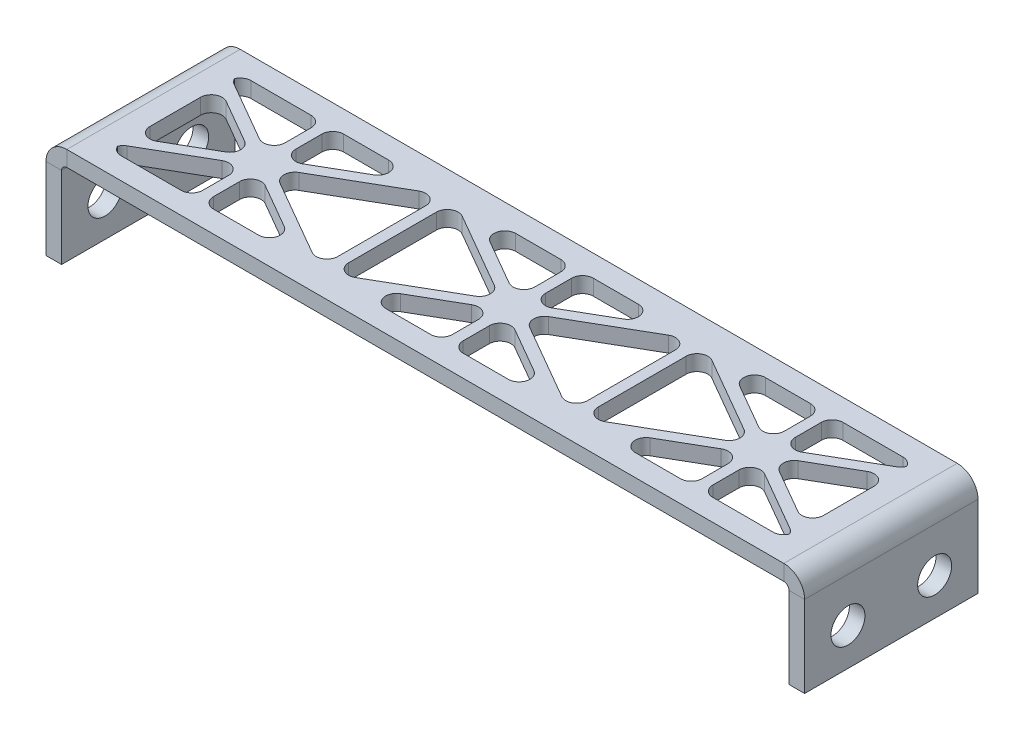
from build123d import *

# Parameters (mm, degrees)
BASE_FLANGE1_DEPTH      = 25.4
CUT_EXTRUDE1_DEPTH      = 62.700339563
CUT_EXTRUDE1_DEPTH_BACK = 62.700339563
SKETCH6_R               = 2.4892
CUT_EXTRUDE4_DEPTH      = 63.904146145
FILLET1_R               = 1.5875


# Sheet-metal steps are written as plain solids
with BuildPart() as part:
    # Sketch1 → Base-Flange1 (new body)
    with BuildSketch(Plane.XY):
        with BuildLine():
            Line((-53.2765, -6.35), (-53.2765, 5.588))
            ThreePointArc((-53.2765, 5.588), (-53.053315367, 6.126815367), (-52.5145, 6.35))
            Line((-52.5145, 6.35), (52.5145, 6.35))
            ThreePointArc((52.5145, 6.35), (53.053315367, 6.126815367), (53.2765, 5.588))
            Line((53.2765, 5.588), (53.2765, -6.35))
            Line((53.2765, -6.35), (55.5625, -6.35))
            Line((55.5625, -6.35), (55.5625, 5.588))
            ThreePointArc((55.5625, 5.588), (54.669761469, 7.743261469), (52.5145, 8.636))
            Line((52.5145, 8.636), (-52.5145, 8.636))
            ThreePointArc((-52.5145, 8.636), (-54.669761469, 7.743261469), (-55.5625, 5.588))
            Line((-55.5625, 5.588), (-55.5625, -6.35))
            Line((-55.5625, -6.35), (-53.2765, -6.35))
        make_face()
    extrude(amount=BASE_FLANGE1_DEPTH)

    # Sketch6 → Cut-Extrude1 (cut, two sides: drawn at the far end of the back side and taken through both)
    with BuildSketch(Plane(origin=(0, 0, 0), x_dir=(0, 0, -1), z_dir=(1, 0, 0)).offset(-CUT_EXTRUDE1_DEPTH_BACK)):
        with Locations((19.05, -0.888959106)):
            Circle(SKETCH6_R)
        with Locations((6.35, -0.888959106)):
            Circle(SKETCH6_R)
        with Locations((-6.35, -0.888959106)):
            Circle(SKETCH6_R)
        with Locations((-19.05, -0.888959106)):
            Circle(SKETCH6_R)
    extrude(amount=CUT_EXTRUDE1_DEPTH + CUT_EXTRUDE1_DEPTH_BACK, mode=Mode.SUBTRACT)

    # Sketch8 → Cut-Extrude4 (cut, through all)
    with BuildSketch(Plane(origin=(0, 8.636, 0), x_dir=(1, 0, 0), z_dir=(0, 1, 0))):
        Polygon((49.3395, -19.152466608), (49.3395, -6.247533392), (38.1635, -12.7), align=None)
        Polygon((49.3395, -22.225), (49.3395, -20.985553713), (37.36975, -14.074815329), (37.36975, -22.225), align=None)
        Polygon((35.78225, -22.225), (35.78225, -14.074815329), (21.665716058, -22.225), align=None)
        Polygon((19.08175, -21.883766394), (34.9885, -12.7), (19.08175, -3.516233606), align=None)
        Polygon((35.78225, -11.325184671), (35.78225, -3.175), (21.665716058, -3.175), align=None)
        Polygon((37.36975, -11.325184671), (49.3395, -4.414446287), (49.3395, -3.175), (37.36975, -3.175), align=None)
        Polygon((17.49425, -21.883766394), (17.49425, -3.516233606), (1.5875, -12.7), align=None)
        Polygon((0.79375, -22.225), (14.910283942, -22.225), (0.79375, -14.074815329), align=None)
        Polygon((0.79375, -11.325184671), (14.910283942, -3.175), (0.79375, -3.175), align=None)
        Polygon((-0.79375, -11.325184671), (-0.79375, -3.175), (-14.910283942, -3.175), align=None)
        Polygon((-17.49425, -21.883766394), (-1.5875, -12.7), (-17.49425, -3.516233606), align=None)
        Polygon((-14.910283942, -22.225), (-0.79375, -22.225), (-0.79375, -14.074815329), align=None)
        Polygon((-19.08175, -21.883766394), (-19.08175, -3.516233606), (-34.9885, -12.7), align=None)
        Polygon((-35.78225, -22.225), (-21.665716058, -22.225), (-35.78225, -14.074815329), align=None)
        Polygon((-35.78225, -11.325184671), (-21.665716058, -3.175), (-35.78225, -3.175), align=None)
        Polygon((-37.36975, -11.325184671), (-37.36975, -3.175), (-49.3395, -3.175), (-49.3395, -4.414446287), align=None)
        Polygon((-49.3395, -19.152466608), (-38.1635, -12.7), (-49.3395, -6.247533392), align=None)
        Polygon((-49.3395, -22.225), (-37.36975, -22.225), (-37.36975, -14.074815329), (-49.3395, -20.985553713), align=None)
    extrude(amount=-CUT_EXTRUDE4_DEPTH, mode=Mode.SUBTRACT)

    # Fillet1
    # the kernel refuses this fillet: 1.5875 mm, written as the material it adds along each edge
    with BuildSketch(Plane(origin=(37.36975, 8.636, 3.175), x_dir=(0, 0, 1), z_dir=(0, -1, 0)), Plane(origin=(49.3395, 8.636, 3.175), x_dir=(-1, 0, 0), z_dir=(0, -1, 0)), Plane(origin=(49.3395, 8.636, 22.225), x_dir=(0, 0, -1), z_dir=(0, -1, 0)), Plane(origin=(35.78225, 8.636, 22.225), x_dir=(0, 0, -1), z_dir=(0, -1, 0)), Plane(origin=(35.78225, 8.636, 3.175), x_dir=(-1, 0, 0), z_dir=(0, -1, 0)), Plane(origin=(-49.3395, 8.636, 3.175), x_dir=(0, 0, 1), z_dir=(0, -1, 0)), Plane(origin=(-37.36975, 8.636, 3.175), x_dir=(-1, 0, 0), z_dir=(0, -1, 0)), Plane(origin=(-0.79375, 8.636, 3.175), x_dir=(-1, 0, 0), z_dir=(0, -1, 0)), Plane(origin=(-0.79375, 8.636, 22.225), x_dir=(0, 0, -1), z_dir=(0, -1, 0)), Plane(origin=(-37.36975, 8.636, 22.225), x_dir=(0, 0, -1), z_dir=(0, -1, 0)), Plane(origin=(-49.3395, 8.636, 22.225), x_dir=(1, 0, 0), z_dir=(0, -1, 0))) as fillet1_piece_1:
        with BuildLine():
            CenterArc((FILLET1_R, -FILLET1_R), FILLET1_R, 90, 90)
            Line((0, -FILLET1_R), (0, 0))
            Line((0, 0), (FILLET1_R, 0))
        make_face()
    extrude(amount=2.286)
    with BuildSketch(Plane(origin=(49.3395, 8.636, 4.414446287), x_dir=(0, 0, -1), z_dir=(0, -1, 0)), Plane(origin=(49.3395, 8.636, 20.985553713), x_dir=(-0.8660254037844429, 0, -0.4999999999999925), z_dir=(0, -1, 0)), Plane(origin=(-49.3395, 8.636, 4.414446287), x_dir=(0.8660254037844405, 0, 0.4999999999999969), z_dir=(0, -1, 0)), Plane(origin=(-49.3395, 8.636, 20.985553713), x_dir=(0, 0, 1), z_dir=(0, -1, 0))) as fillet1_piece_2:
        with BuildLine():
            CenterArc((FILLET1_R * 0.57735026919, -FILLET1_R), FILLET1_R, 90, 60)
            Line((-FILLET1_R * 0.288675134595, -FILLET1_R * 0.5), (0, 0))
            Line((0, 0), (FILLET1_R * 0.57735026919, 0))
        make_face()
    extrude(amount=2.286)
    with BuildSketch(Plane(origin=(37.36975, 8.636, 11.325184671), x_dir=(0, 0, -1), z_dir=(0, -1, 0)), Plane(origin=(1.5875, 8.636, 12.7), x_dir=(0.8660254037844406, 0, -0.4999999999999966), z_dir=(0, -1, 0)), Plane(origin=(35.78225, 8.636, 11.325184671), x_dir=(-0.8660254037844403, 0, -0.49999999999999717), z_dir=(0, -1, 0)), Plane(origin=(19.08175, 8.636, 21.883766394), x_dir=(0, 0, -1), z_dir=(0, -1, 0)), Plane(origin=(-37.36975, 8.636, 11.325184671), x_dir=(-0.8660254037844397, 0, -0.49999999999999817), z_dir=(0, -1, 0)), Plane(origin=(-49.3395, 8.636, 19.152466608), x_dir=(0, 0, -1), z_dir=(0, -1, 0)), Plane(origin=(-17.49425, 8.636, 21.883766394), x_dir=(0, 0, -1), z_dir=(0, -1, 0)), Plane(origin=(-0.79375, 8.636, 11.325184671), x_dir=(-0.8660254037844397, 0, -0.4999999999999983), z_dir=(0, -1, 0)), Plane(origin=(-0.79375, 8.636, 14.074815329), x_dir=(0, 0, 1), z_dir=(0, -1, 0)), Plane(origin=(-34.9885, 8.636, 12.7), x_dir=(0.8660254037844405, 0, -0.49999999999999667), z_dir=(0, -1, 0)), Plane(origin=(-37.36975, 8.636, 14.074815329), x_dir=(0, 0, 1), z_dir=(0, -1, 0)), Plane(origin=(49.3395, 8.636, 19.152466608), x_dir=(-0.8660254037844397, 0, -0.49999999999999817), z_dir=(0, -1, 0))) as fillet1_piece_3:
        with BuildLine():
            CenterArc((FILLET1_R * 1.73205080757, FILLET1_R), FILLET1_R, 150, 120)
            Line((FILLET1_R * 0.866025403784, FILLET1_R * 1.5), (0, 0))
            Line((0, 0), (FILLET1_R * 1.73205080757, 0))
        make_face()
    extrude(amount=2.286)
    with BuildSketch(Plane(origin=(17.49425, 8.636, 3.516233606), x_dir=(-0.8660254037844396, 0, 0.49999999999999817), z_dir=(0, -1, 0)), Plane(origin=(17.49425, 8.636, 21.883766394), x_dir=(0, 0, -1), z_dir=(0, -1, 0)), Plane(origin=(0.79375, 8.636, 14.074815329), x_dir=(0, 0, 1), z_dir=(0, -1, 0)), Plane(origin=(0.79375, 8.636, 11.325184671), x_dir=(0.8660254037844398, 0, -0.4999999999999979), z_dir=(0, -1, 0)), Plane(origin=(37.36975, 8.636, 14.074815329), x_dir=(0, 0, 1), z_dir=(0, -1, 0)), Plane(origin=(35.78225, 8.636, 14.074815329), x_dir=(-0.8660254037844395, 0, 0.4999999999999986), z_dir=(0, -1, 0)), Plane(origin=(19.08175, 8.636, 3.516233606), x_dir=(0, 0, 1), z_dir=(0, -1, 0)), Plane(origin=(34.9885, 8.636, 12.7), x_dir=(-0.866025403784439, 0, -0.4999999999999993), z_dir=(0, -1, 0)), Plane(origin=(-38.1635, 8.636, 12.7), x_dir=(-0.8660254037844394, 0, -0.4999999999999986), z_dir=(0, -1, 0)), Plane(origin=(-49.3395, 8.636, 6.247533392), x_dir=(0, 0, 1), z_dir=(0, -1, 0)), Plane(origin=(-35.78225, 8.636, 11.325184671), x_dir=(0.86602540378444, 0, -0.49999999999999767), z_dir=(0, -1, 0)), Plane(origin=(-35.78225, 8.636, 14.074815329), x_dir=(0, 0, 1), z_dir=(0, -1, 0)), Plane(origin=(-17.49425, 8.636, 3.516233606), x_dir=(0, 0, 1), z_dir=(0, -1, 0)), Plane(origin=(-1.5875, 8.636, 12.7), x_dir=(-0.8660254037844406, 0, -0.4999999999999966), z_dir=(0, -1, 0)), Plane(origin=(-19.08175, 8.636, 3.516233606), x_dir=(-0.8660254037844397, 0, 0.499999999999998), z_dir=(0, -1, 0)), Plane(origin=(-19.08175, 8.636, 21.883766394), x_dir=(0, 0, -1), z_dir=(0, -1, 0)), Plane(origin=(49.3395, 8.636, 6.247533392), x_dir=(-0.8660254037844402, 0, 0.4999999999999975), z_dir=(0, -1, 0)), Plane(origin=(38.1635, 8.636, 12.7), x_dir=(0.8660254037844394, 0, 0.4999999999999986), z_dir=(0, -1, 0))) as fillet1_piece_4:
        with BuildLine():
            CenterArc((FILLET1_R * 1.73205080757, -FILLET1_R), FILLET1_R, 90, 120)
            Line((FILLET1_R * 0.866025403784, -FILLET1_R * 1.5), (0, 0))
            Line((0, 0), (FILLET1_R * 1.73205080757, 0))
        make_face()
    extrude(amount=2.286)
    with BuildSketch(Plane(origin=(14.910283942, 8.636, 22.225), x_dir=(-0.8660254037844399, 0, -0.49999999999999767), z_dir=(0, -1, 0)), Plane(origin=(14.910283942, 8.636, 3.175), x_dir=(-1, 0, 0), z_dir=(0, -1, 0)), Plane(origin=(21.665716058, 8.636, 3.175), x_dir=(0.8660254037844398, 0, 0.4999999999999979), z_dir=(0, -1, 0)), Plane(origin=(-21.665716058, 8.636, 3.175), x_dir=(-1, 0, 0), z_dir=(0, -1, 0)), Plane(origin=(-21.665716058, 8.636, 22.225), x_dir=(-0.8660254037844397, 0, -0.49999999999999806), z_dir=(0, -1, 0)), Plane(origin=(-14.910283942, 8.636, 3.175), x_dir=(0.8660254037844397, 0, 0.499999999999998), z_dir=(0, -1, 0)), Plane(origin=(-14.910283942, 8.636, 22.225), x_dir=(1, 0, 0), z_dir=(0, -1, 0))) as fillet1_piece_5:
        with BuildLine():
            CenterArc((FILLET1_R * 3.73205080757, -FILLET1_R), FILLET1_R, 90, 150)
            Line((FILLET1_R * 3.23205080757, -FILLET1_R * 1.86602540378), (0, 0))
            Line((0, 0), (FILLET1_R * 3.73205080757, 0))
        make_face()
    extrude(amount=2.286)
    with BuildSketch(Plane(origin=(0.79375, 8.636, 22.225), x_dir=(0, 0, -1), z_dir=(0, -1, 0)), Plane(origin=(0.79375, 8.636, 3.175), x_dir=(1, 0, 0), z_dir=(0, -1, 0)), Plane(origin=(37.36975, 8.636, 22.225), x_dir=(0, 0, -1), z_dir=(0, -1, 0)), Plane(origin=(-35.78225, 8.636, 3.175), x_dir=(1, 0, 0), z_dir=(0, -1, 0)), Plane(origin=(-35.78225, 8.636, 22.225), x_dir=(0, 0, -1), z_dir=(0, -1, 0))) as fillet1_piece_6:
        with BuildLine():
            CenterArc((FILLET1_R, FILLET1_R), FILLET1_R, 180, 90)
            Line((0, FILLET1_R), (0, 0))
            Line((0, 0), (FILLET1_R, 0))
        make_face()
    extrude(amount=2.286)
    with BuildSketch(Plane(origin=(21.665716058, 8.636, 22.225), x_dir=(0.8660254037844399, 0, -0.49999999999999784), z_dir=(0, -1, 0))) as fillet1_piece_7:
        with BuildLine():
            CenterArc((FILLET1_R * 3.73205080757, FILLET1_R), FILLET1_R, 120, 150)
            Line((FILLET1_R * 3.23205080757, FILLET1_R * 1.86602540378), (0, 0))
            Line((0, 0), (FILLET1_R * 3.73205080757, 0))
        make_face()
    extrude(amount=2.286)


solid = part.part
